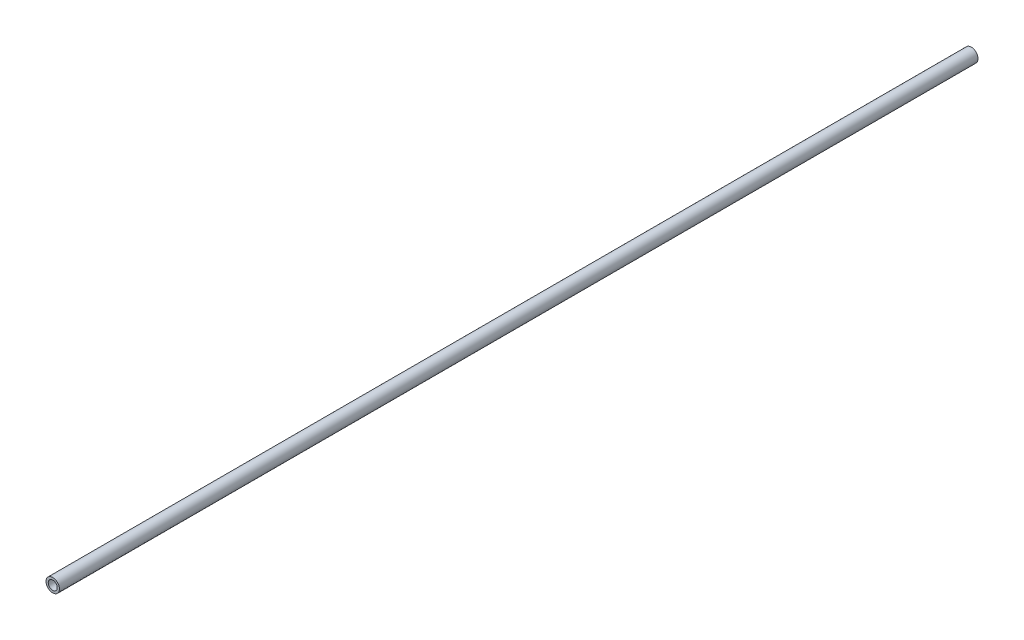
from build123d import *

# Parameters (mm, degrees)
SKETCH_1_R      = 3
SKETCH_1_R_2    = 2
EXTRUDE_1_DEPTH = 205


with BuildPart() as part:
    # Эскиз1 → Бобышка-Вытянуть1 (new, symmetric)
    with BuildSketch(Plane.XY):
        Circle(SKETCH_1_R)
        Circle(SKETCH_1_R_2, mode=Mode.SUBTRACT)
    extrude(amount=EXTRUDE_1_DEPTH, both=True)


solid = part.part
